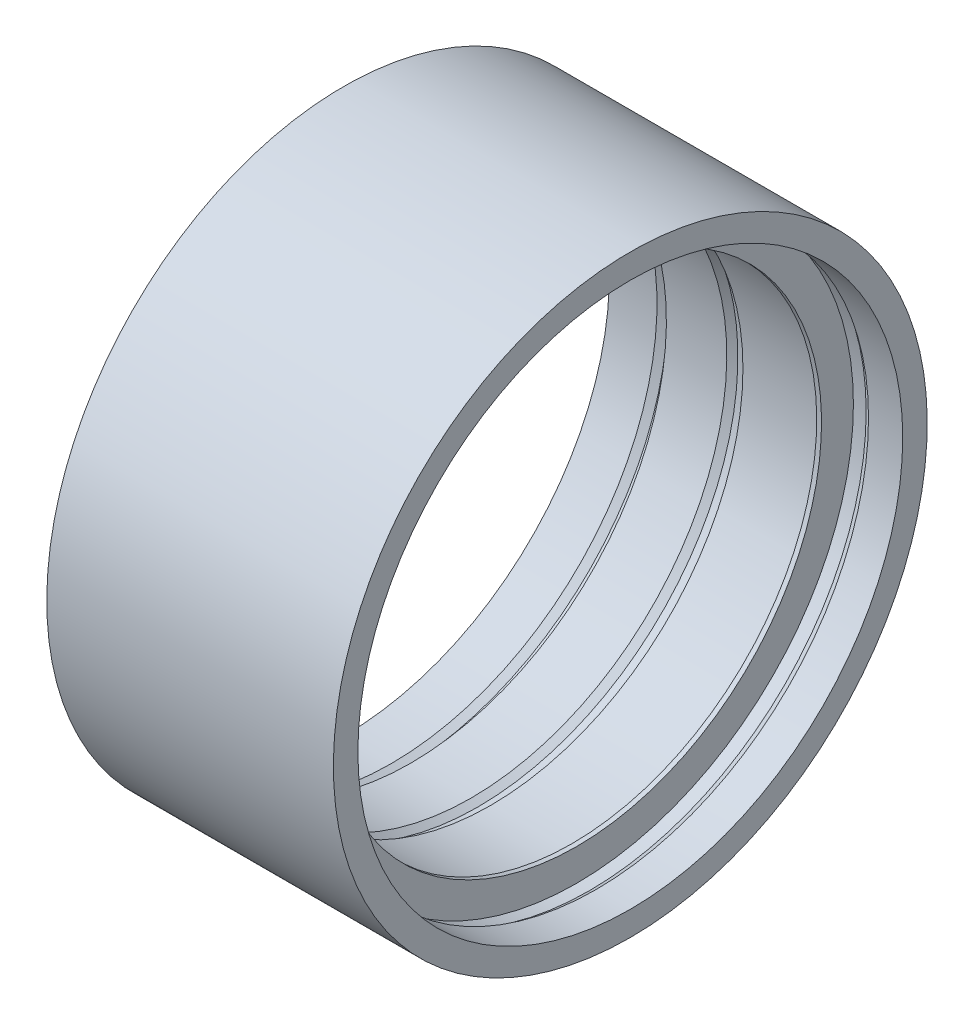
from build123d import *


with BuildPart() as part:
    # Skica2 → Rotovat1 (revolve)
    with BuildSketch(Plane.XY):
        Polygon((-36.713340937, -44.25), (6, -44.25), (6, -40.6), (0.9, -40.6), (-0.1, -41.25), (-2, -41.25), (-2, -36.5), (-2.716675115, -36.5), (-2.883909622, -37.600000008), (-14.813340937, -37.600000008), (-14.813340937, -38.75), (-16.713340937, -38.75), (-17.713340937, -38.094), (-26.713340937, -38.094), (-26.713340937, -40.25), (-28.613340937, -40.25), (-29.613340937, -39.594), (-36.713340937, -39.594), align=None)
    revolve(axis=Axis((0, 0, 0), (1, 0, 0)))


solid = part.part
